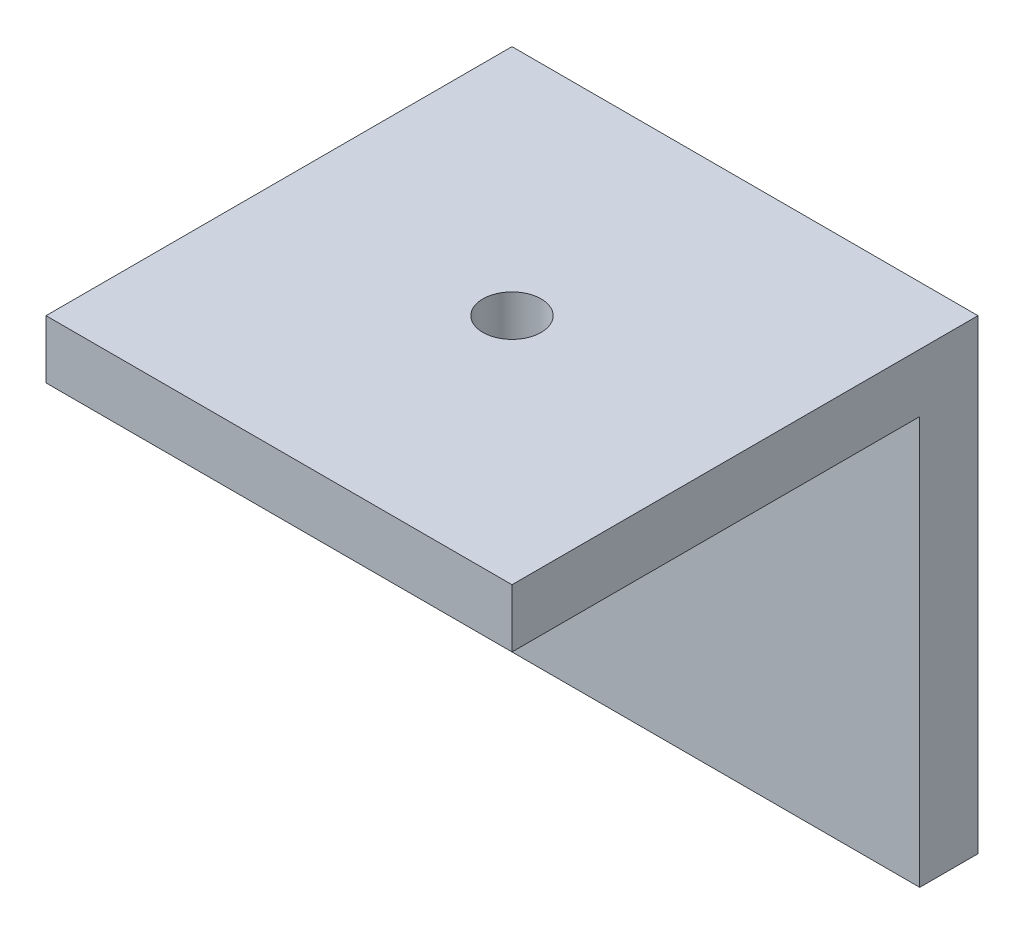
from build123d import *

# Parameters (mm, degrees)
SKETCH_2_W          = 25.4
SKETCH_2_H          = 25.4
SKETCH_2_R          = 1.5875
EXTRUDE_1_DEPTH     = 3.175
SKETCH_3_W          = 25.4
SKETCH_3_H          = 3.175
EXTRUDE_2_DEPTH     = 22.225
SKETCH_4_R          = 1.5875
CUT_EXTRUDE_1_DEPTH = 22.225


with BuildPart() as part:
    # 스케치2 → 보스-돌출1 (new body)
    with BuildSketch(Plane.XY):
        Rectangle(SKETCH_2_W, SKETCH_2_H)
        Circle(SKETCH_2_R, mode=Mode.SUBTRACT)
    extrude(amount=EXTRUDE_1_DEPTH)

    # 스케치3 → 보스-돌출2 (add)
    with BuildSketch(Plane.XY.offset(3.175)):
        with Locations((0, 11.1125)):
            Rectangle(SKETCH_3_W, SKETCH_3_H)
    extrude(amount=EXTRUDE_2_DEPTH)

    # 스케치4 → 컷-돌출1 (cut)
    with BuildSketch(Plane(origin=(0, 12.7, 0), x_dir=(1, 0, 0), z_dir=(0, 1, 0))):
        with Locations((0, -12.7)):
            Circle(SKETCH_4_R)
    extrude(amount=-CUT_EXTRUDE_1_DEPTH, mode=Mode.SUBTRACT)


solid = part.part
